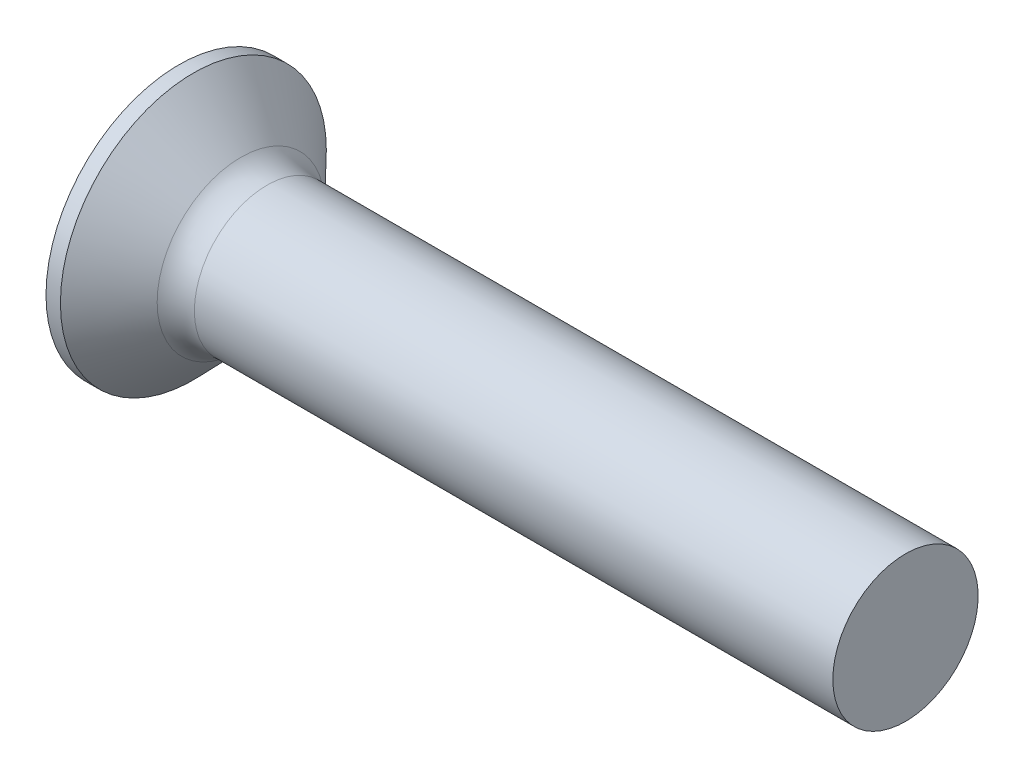
from build123d import *

# Parameters (mm, degrees)
FILLET1_R    = 2.5
RECPAT_COUNT = 2
RECPAT_ANGLE = 90


with BuildPart() as part:
    # BodySke → Base-Revolve (revolve)
    with BuildSketch(Plane.XY):
        with BuildLine():
            Line((0, 0), (52.3, 0))
            Line((52.3, 0), (52.3, 5))
            Line((52.3, 5), (7.3, 5))
            Line((7.3, 5), (3.292391585, 9.15))
            Line((3.292391585, 9.15), (2.3, 9.15))
            ThreePointArc((2.3, 9.15), (0.583806737, 4.717321804), (0, 0))
        make_face()
    revolve(axis=Axis((-15.875, 0, 0), (1, 0, 0)))

    # Fillet1
    fillet1_edges = [part.edges().sort_by_distance(p)[0] for p in [
        (7.3, -5, 0),
    ]]
    fillet(fillet1_edges, radius=FILLET1_R)

    # Sketch3 → Recess section 0
    with BuildSketch(Plane(origin=(0, 0, 0), x_dir=(0, 0, -1), z_dir=(1, 0, 0))):
        with BuildLine():
            Line((1.08, -5.15), (-1.08, -5.15))
            Line((-1.08, -5.15), (-1.08, 5.15))
            Line((-1.08, 5.15), (1.08, 5.15))
            Line((1.08, 5.15), (1.08, -5.15))
        make_face()
    # Sketch4 → Recess section 1
    with BuildSketch(Plane(origin=(6.05, 0, 0), x_dir=(0, 0, -1), z_dir=(1, 0, 0))):
        with BuildLine():
            Line((1.08, -2.133581776), (-1.08, -2.133581776))
            Line((-1.08, -2.133581776), (-1.08, 2.133581776))
            Line((-1.08, 2.133581776), (1.08, 2.133581776))
            Line((1.08, 2.133581776), (1.08, -2.133581776))
        make_face()
    recess = loft(mode=Mode.SUBTRACT)

    # RecPat: Recess ×2 about axis
    recpat_axis = Axis((-15.875, 0, 0), (1, 0, 0))
    for i in range(1, RECPAT_COUNT):
        add(recess.rotate(recpat_axis, i * RECPAT_ANGLE / (RECPAT_COUNT - 1)), mode=Mode.SUBTRACT)

    # RecCorSke → RecessCore (revolve, cut)
    with BuildSketch(Plane.XY):
        Polygon((0, 0), (0, 2.353557212), (6.05, 1.9305), (6.677257474, 0), align=None)
    revolve(axis=Axis((-3.175, 0, 0), (1, 0, 0)), mode=Mode.SUBTRACT)


solid = part.part
